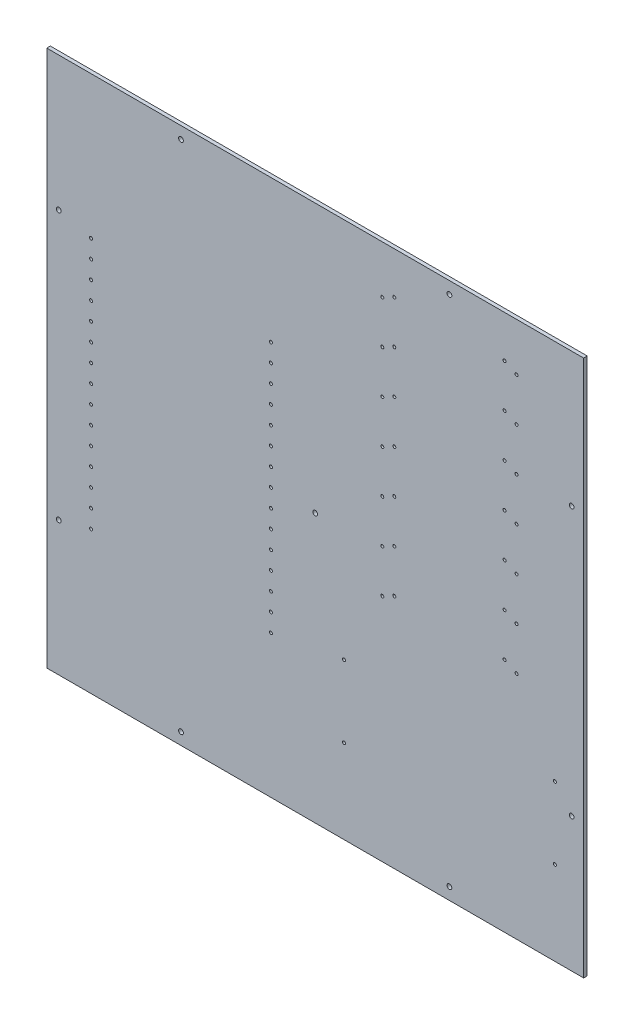
from build123d import *

# Parameters (mm, degrees)
SCHIZZO1_W                   = 448
SCHIZZO1_H                   = 448
SCHIZZO1_R                   = 2
SCHIZZO1_R_2                 = 1.25
ESTRUSIONE_ESTRUSIONE1_DEPTH = 3


with BuildPart() as part:
    # Schizzo1 → Estrusione-Estrusione1 (new body)
    with BuildSketch(Plane.XY):
        with Locations((224, 224)):
            Rectangle(SCHIZZO1_W, SCHIZZO1_H)
        with Locations((10, 336)):
            Circle(SCHIZZO1_R, mode=Mode.SUBTRACT)
        with Locations((336, 438)):
            Circle(SCHIZZO1_R, mode=Mode.SUBTRACT)
        with Locations((438, 336)):
            Circle(SCHIZZO1_R, mode=Mode.SUBTRACT)
        with Locations((438, 112)):
            Circle(SCHIZZO1_R, mode=Mode.SUBTRACT)
        with Locations((336, 10)):
            Circle(SCHIZZO1_R, mode=Mode.SUBTRACT)
        with Locations((112, 10)):
            Circle(SCHIZZO1_R, mode=Mode.SUBTRACT)
        with Locations((10, 112)):
            Circle(SCHIZZO1_R, mode=Mode.SUBTRACT)
        with Locations((36.958788995, 224)):
            Circle(SCHIZZO1_R_2, mode=Mode.SUBTRACT)
        with Locations((112, 438)):
            Circle(SCHIZZO1_R, mode=Mode.SUBTRACT)
        with Locations((36.958788995, 239)):
            Circle(SCHIZZO1_R_2, mode=Mode.SUBTRACT)
        with Locations((36.958788995, 254)):
            Circle(SCHIZZO1_R_2, mode=Mode.SUBTRACT)
        with Locations((36.958788995, 269)):
            Circle(SCHIZZO1_R_2, mode=Mode.SUBTRACT)
        with Locations((36.958788995, 284)):
            Circle(SCHIZZO1_R_2, mode=Mode.SUBTRACT)
        with Locations((36.958788995, 299)):
            Circle(SCHIZZO1_R_2, mode=Mode.SUBTRACT)
        with Locations((36.958788995, 314)):
            Circle(SCHIZZO1_R_2, mode=Mode.SUBTRACT)
        with Locations((36.958788995, 329)):
            Circle(SCHIZZO1_R_2, mode=Mode.SUBTRACT)
        with Locations((248, 70)):
            Circle(SCHIZZO1_R_2, mode=Mode.SUBTRACT)
        with Locations((248, 130)):
            Circle(SCHIZZO1_R_2, mode=Mode.SUBTRACT)
        with Locations((424, 130)):
            Circle(SCHIZZO1_R_2, mode=Mode.SUBTRACT)
        with Locations((424, 70)):
            Circle(SCHIZZO1_R_2, mode=Mode.SUBTRACT)
        with Locations((290, 413)):
            Circle(SCHIZZO1_R_2, mode=Mode.SUBTRACT)
        with Locations((280, 408)):
            Circle(SCHIZZO1_R_2, mode=Mode.SUBTRACT)
        with Locations((392, 408)):
            Circle(SCHIZZO1_R_2, mode=Mode.SUBTRACT)
        with Locations((382, 413)):
            Circle(SCHIZZO1_R_2, mode=Mode.SUBTRACT)
        with Locations((290, 377)):
            Circle(SCHIZZO1_R_2, mode=Mode.SUBTRACT)
        with Locations((280, 372)):
            Circle(SCHIZZO1_R_2, mode=Mode.SUBTRACT)
        with Locations((392, 372)):
            Circle(SCHIZZO1_R_2, mode=Mode.SUBTRACT)
        with Locations((382, 377)):
            Circle(SCHIZZO1_R_2, mode=Mode.SUBTRACT)
        with Locations((290, 341)):
            Circle(SCHIZZO1_R_2, mode=Mode.SUBTRACT)
        with Locations((280, 336)):
            Circle(SCHIZZO1_R_2, mode=Mode.SUBTRACT)
        with Locations((392, 336)):
            Circle(SCHIZZO1_R_2, mode=Mode.SUBTRACT)
        with Locations((382, 341)):
            Circle(SCHIZZO1_R_2, mode=Mode.SUBTRACT)
        with Locations((290, 305)):
            Circle(SCHIZZO1_R_2, mode=Mode.SUBTRACT)
        with Locations((280, 300)):
            Circle(SCHIZZO1_R_2, mode=Mode.SUBTRACT)
        with Locations((392, 300)):
            Circle(SCHIZZO1_R_2, mode=Mode.SUBTRACT)
        with Locations((382, 305)):
            Circle(SCHIZZO1_R_2, mode=Mode.SUBTRACT)
        with Locations((290, 269)):
            Circle(SCHIZZO1_R_2, mode=Mode.SUBTRACT)
        with Locations((280, 264)):
            Circle(SCHIZZO1_R_2, mode=Mode.SUBTRACT)
        with Locations((392, 264)):
            Circle(SCHIZZO1_R_2, mode=Mode.SUBTRACT)
        with Locations((382, 269)):
            Circle(SCHIZZO1_R_2, mode=Mode.SUBTRACT)
        with Locations((290, 233)):
            Circle(SCHIZZO1_R_2, mode=Mode.SUBTRACT)
        with Locations((280, 228)):
            Circle(SCHIZZO1_R_2, mode=Mode.SUBTRACT)
        with Locations((392, 228)):
            Circle(SCHIZZO1_R_2, mode=Mode.SUBTRACT)
        with Locations((382, 233)):
            Circle(SCHIZZO1_R_2, mode=Mode.SUBTRACT)
        with Locations((290, 197)):
            Circle(SCHIZZO1_R_2, mode=Mode.SUBTRACT)
        with Locations((280, 192)):
            Circle(SCHIZZO1_R_2, mode=Mode.SUBTRACT)
        with Locations((392, 192)):
            Circle(SCHIZZO1_R_2, mode=Mode.SUBTRACT)
        with Locations((382, 197)):
            Circle(SCHIZZO1_R_2, mode=Mode.SUBTRACT)
        with Locations((36.958788995, 119)):
            Circle(SCHIZZO1_R_2, mode=Mode.SUBTRACT)
        with Locations((36.958788995, 134)):
            Circle(SCHIZZO1_R_2, mode=Mode.SUBTRACT)
        with Locations((36.958788995, 149)):
            Circle(SCHIZZO1_R_2, mode=Mode.SUBTRACT)
        with Locations((36.958788995, 164)):
            Circle(SCHIZZO1_R_2, mode=Mode.SUBTRACT)
        with Locations((36.958788995, 179)):
            Circle(SCHIZZO1_R_2, mode=Mode.SUBTRACT)
        with Locations((36.958788995, 194)):
            Circle(SCHIZZO1_R_2, mode=Mode.SUBTRACT)
        with Locations((36.958788995, 209)):
            Circle(SCHIZZO1_R_2, mode=Mode.SUBTRACT)
        with Locations((187.041211005, 209)):
            Circle(SCHIZZO1_R_2, mode=Mode.SUBTRACT)
        with Locations((187.041211005, 194)):
            Circle(SCHIZZO1_R_2, mode=Mode.SUBTRACT)
        with Locations((187.041211005, 179)):
            Circle(SCHIZZO1_R_2, mode=Mode.SUBTRACT)
        with Locations((187.041211005, 164)):
            Circle(SCHIZZO1_R_2, mode=Mode.SUBTRACT)
        with Locations((187.041211005, 149)):
            Circle(SCHIZZO1_R_2, mode=Mode.SUBTRACT)
        with Locations((187.041211005, 134)):
            Circle(SCHIZZO1_R_2, mode=Mode.SUBTRACT)
        with Locations((187.041211005, 119)):
            Circle(SCHIZZO1_R_2, mode=Mode.SUBTRACT)
        with Locations((187.041211005, 329)):
            Circle(SCHIZZO1_R_2, mode=Mode.SUBTRACT)
        with Locations((187.041211005, 314)):
            Circle(SCHIZZO1_R_2, mode=Mode.SUBTRACT)
        with Locations((187.041211005, 299)):
            Circle(SCHIZZO1_R_2, mode=Mode.SUBTRACT)
        with Locations((187.041211005, 284)):
            Circle(SCHIZZO1_R_2, mode=Mode.SUBTRACT)
        with Locations((187.041211005, 269)):
            Circle(SCHIZZO1_R_2, mode=Mode.SUBTRACT)
        with Locations((187.041211005, 254)):
            Circle(SCHIZZO1_R_2, mode=Mode.SUBTRACT)
        with Locations((187.041211005, 239)):
            Circle(SCHIZZO1_R_2, mode=Mode.SUBTRACT)
        with Locations((187.041211005, 224)):
            Circle(SCHIZZO1_R_2, mode=Mode.SUBTRACT)
        with Locations((224, 224)):
            Circle(SCHIZZO1_R, mode=Mode.SUBTRACT)
    extrude(amount=-ESTRUSIONE_ESTRUSIONE1_DEPTH)


solid = part.part
